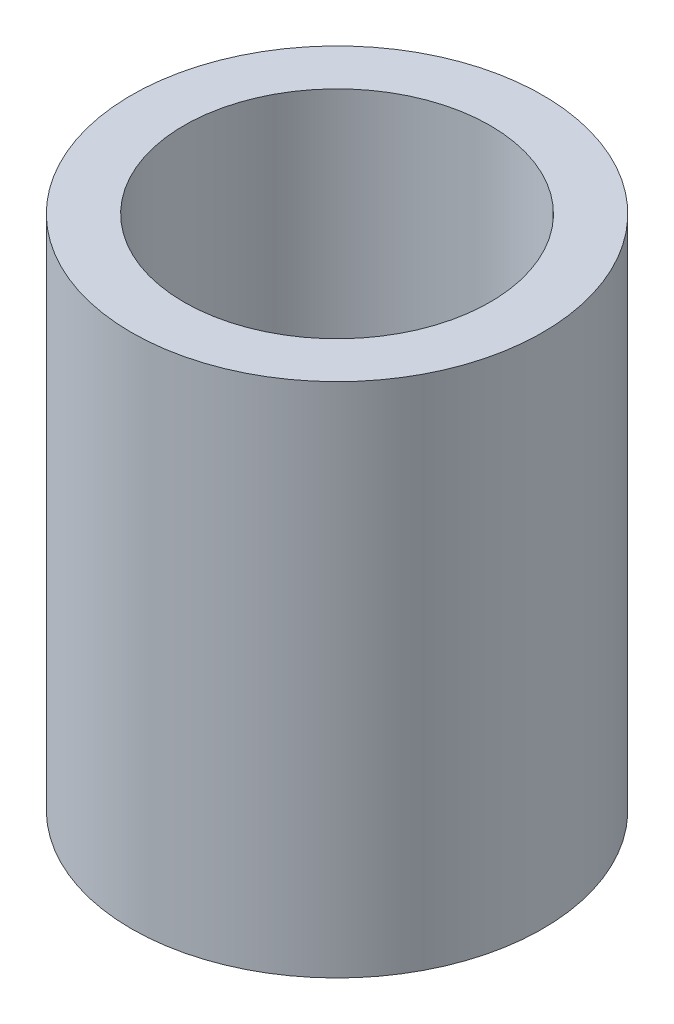
from build123d import *

# Parameters (mm, degrees)
SKETCH1_R           = 30
BOSS_EXTRUDE1_DEPTH = 75.354898448
SKETCH2_R           = 22.332125753
CUT_EXTRUDE1_DEPTH  = 87.477515691


with BuildPart() as part:
    # Sketch1 → Boss-Extrude1 (new body)
    with BuildSketch(Plane(origin=(0, 0, 0), x_dir=(1, 0, 0), z_dir=(0, 1, 0))):
        Circle(SKETCH1_R)
    extrude(amount=BOSS_EXTRUDE1_DEPTH)

    # Sketch2 → Cut-Extrude1 (cut, through all)
    with BuildSketch(Plane(origin=(0, 0, 0), x_dir=(1, 0, 0), z_dir=(0, 1, 0))):
        Circle(SKETCH2_R)
    extrude(amount=CUT_EXTRUDE1_DEPTH, mode=Mode.SUBTRACT)


solid = part.part
